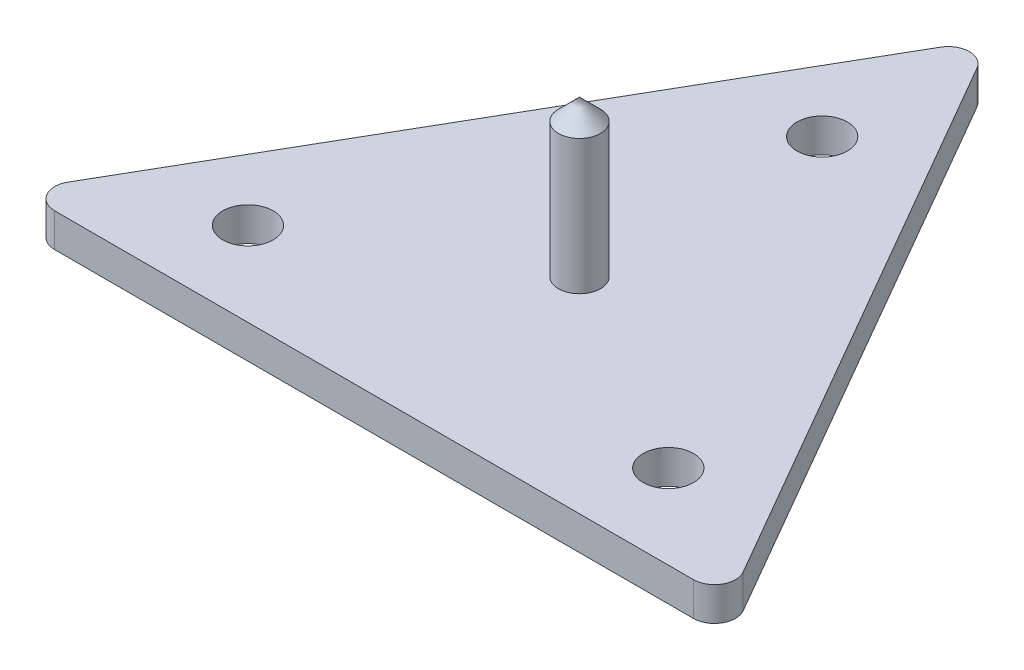
from build123d import *

# Parameters (mm, degrees)
BOSS_EXTRUDE1_DEPTH        = 8
F_12_0_12_DIAMETER_HOLE1_D = 12
SKETCH8_R                  = 5
BOSS_EXTRUDE2_DEPTH        = 45
FILLET1_R                  = 5
CHAMFER1_SIZE              = 5


with BuildPart() as part:
    # Sketch1 → Boss-Extrude1 (new body)
    with BuildSketch(Plane(origin=(0, 0, 0), x_dir=(1, 0, 0), z_dir=(0, 1, 0))):
        Polygon((-65.68627451, 247.111542704), (18.954741642, 100.509002326), (-150.327290661, 100.509002326), align=None)
    extrude(amount=BOSS_EXTRUDE1_DEPTH)

    # Ø12.0 (12) Diameter Hole1 (through all)
    with Locations(Plane(origin=(0, 8, 0), x_dir=(1, 0, 0), z_dir=(0, 1, 0))):
        with Locations((-65.68627451, 207.111542704), (-115.68627451, 120.509002326), (-15.68627451, 120.509002326)):
            Hole(F_12_0_12_DIAMETER_HOLE1_D / 2)

    # Sketch8 → Boss-Extrude2 (add)
    with BuildSketch(Plane(origin=(0, 0, 0), x_dir=(-1, 0, 0), z_dir=(0, -1, 0))):
        with Locations((65.68627451, 149.376515785)):
            Circle(SKETCH8_R)
    extrude(amount=-BOSS_EXTRUDE2_DEPTH)

    # Fillet1
    fillet1_edges = [part.edges().sort_by_distance(p)[0] for p in [
        (-150.327290661, 4, -100.509002326),
        (-65.68627451, 4, -247.111542704),
        (18.954741642, 4, -100.509002326),
    ]]
    fillet(fillet1_edges, radius=FILLET1_R)

    # Chamfer1
    chamfer1_edges = [part.edges().sort_by_distance(p)[0] for p in [
        (-60.68627451, 45, -149.376515785),
    ]]
    chamfer(chamfer1_edges, length=CHAMFER1_SIZE)


solid = part.part
